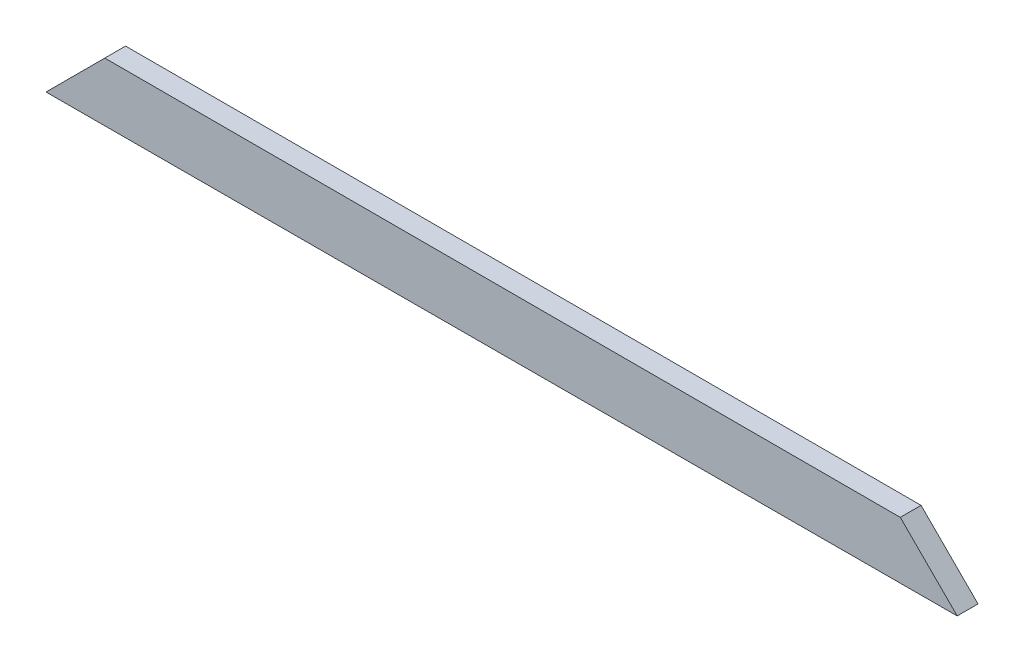
from build123d import *

# Parameters (mm, degrees)
BOSS_EXTRUDE1_DEPTH = 3.175


with BuildPart() as part:
    # Sketch1 → Boss-Extrude1 (new, symmetric)
    with BuildSketch(Plane.XY):
        Polygon((-139.443807584, -165.884900532), (138.870288723, -165.311381671), (121.483295342, -147.92438829), (-121.483295342, -147.92438829), align=None)
    extrude(amount=BOSS_EXTRUDE1_DEPTH, both=True)


solid = part.part
